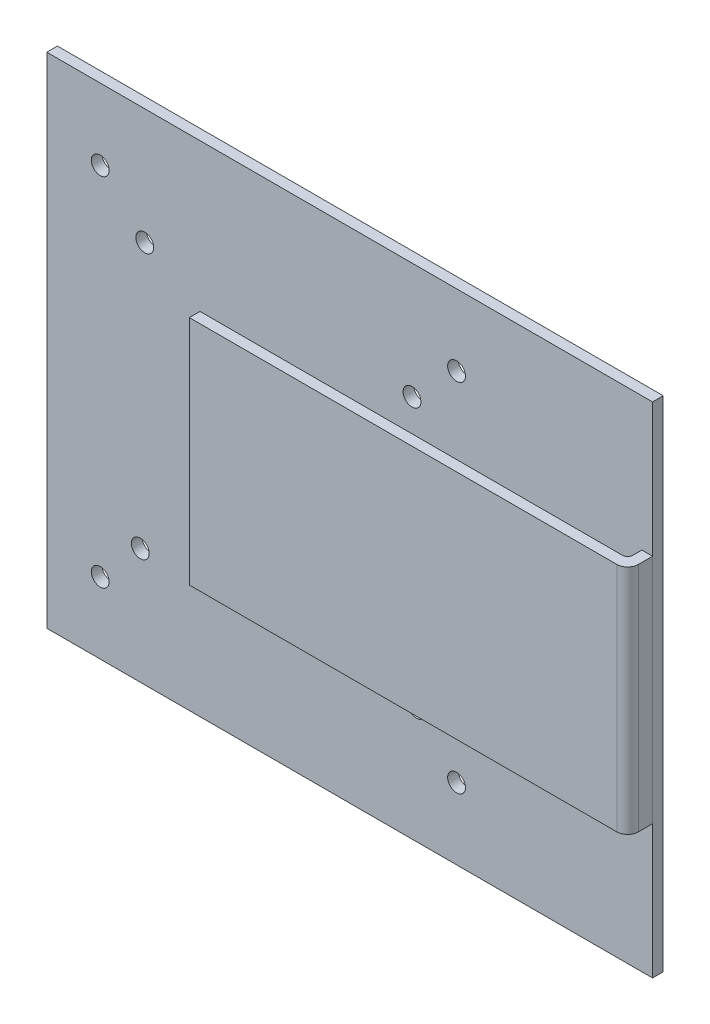
from build123d import *

# Parameters (mm, degrees)
SKETCH1_W            = 150
SKETCH1_H            = 150
BASE_FLANGE1_DEPTH   = 3
SKETCH23_W           = 150
SKETCH23_H           = 150
SKETCH23_W_2         = 140
SKETCH23_H_2         = 140
BOSS_EXTRUDE3_DEPTH  = 20
SKETCH27_W           = 7
SKETCH27_H           = 150
BOSS_EXTRUDE4_DEPTH  = 20
SKETCH31_R           = 2.5
CUT_EXTRUDE1_DEPTH   = 20
SKETCH33_W           = 170
SKETCH33_H           = 150
CUT_EXTRUDE3_DEPTH   = 20
SKETCH34_W           = 150
SKETCH34_H           = 150
SKETCH34_W_2         = 130
SKETCH34_H_2         = 130
CUT_EXTRUDE4_DEPTH   = 20
SKETCH39_W           = 40
SKETCH39_H           = 130
BOSS_EXTRUDE11_DEPTH = 3
BOSS_EXTRUDE14_DEPTH = 3
SKETCH47_W           = 3
SKETCH47_H           = 65
BOSS_EXTRUDE15_DEPTH = 120
FILLET3_R            = 1.5
FILLET4_R            = 3
SKETCH48_W           = 170
SKETCH48_H           = 3
BOSS_EXTRUDE16_DEPTH = 5
SKETCH49_W           = 170
SKETCH49_H           = 3
BOSS_EXTRUDE17_DEPTH = 5


# Sheet-metal steps are written as plain solids
with BuildPart() as part:
    # Sketch1 → Base-Flange1 (new body)
    with BuildSketch(Plane.XY):
        Rectangle(SKETCH1_W, SKETCH1_H)
    extrude(amount=-BASE_FLANGE1_DEPTH)

    # Sketch23 → Boss-Extrude3 (add)
    with BuildSketch(Plane(origin=(0, 0, -3), x_dir=(-1, 0, 0), z_dir=(0, 0, -1))):
        Rectangle(SKETCH23_W, SKETCH23_H)
        Rectangle(SKETCH23_W_2, SKETCH23_H_2, mode=Mode.SUBTRACT)
    extrude(amount=BOSS_EXTRUDE3_DEPTH)

    # Sketch27 → Boss-Extrude4 (add)
    with BuildSketch(Plane(origin=(75, 0, 0), x_dir=(0, 0, -1), z_dir=(1, 0, 0))):
        with Locations((19.5, 0)):
            Rectangle(SKETCH27_W, SKETCH27_H)
    extrude(amount=BOSS_EXTRUDE4_DEPTH)

    # Sketch31 → Cut-Extrude1 (cut)
    with BuildSketch(Plane.XY):
        with Locations((-50, -50)):
            Circle(SKETCH31_R)
        with Locations((-50, 50)):
            Circle(SKETCH31_R)
        with Locations((50, 50)):
            Circle(SKETCH31_R)
        with Locations((50, -50)):
            Circle(SKETCH31_R)
        with Locations((37.5, 37.5)):
            Circle(SKETCH31_R)
        with Locations((-37.5, 37.5)):
            Circle(SKETCH31_R)
        with Locations((38.751749061, -37.489553434)):
            Circle(SKETCH31_R)
        with Locations((-38.751749061, -37.489553434)):
            Circle(SKETCH31_R)
    extrude(amount=-CUT_EXTRUDE1_DEPTH, mode=Mode.SUBTRACT)

    # Sketch33 → Cut-Extrude3 (cut)
    with BuildSketch(Plane(origin=(0, 0, -23), x_dir=(-1, 0, 0), z_dir=(0, 0, -1))):
        with Locations((-10, 0)):
            Rectangle(SKETCH33_W, SKETCH33_H)
    extrude(amount=-CUT_EXTRUDE3_DEPTH, mode=Mode.SUBTRACT)

    # Sketch34 → Cut-Extrude4 (cut)
    with BuildSketch(Plane.XY):
        Rectangle(SKETCH34_W, SKETCH34_H)
        Rectangle(SKETCH34_W_2, SKETCH34_H_2, mode=Mode.SUBTRACT)
    extrude(amount=-CUT_EXTRUDE4_DEPTH, mode=Mode.SUBTRACT)

    # Sketch39 → Boss-Extrude11 (add)
    with BuildSketch(Plane.XY):
        with Locations((85, 0)):
            Rectangle(SKETCH39_W, SKETCH39_H)
    extrude(amount=-BOSS_EXTRUDE11_DEPTH)

    # Sketch48 → Boss-Extrude16 (add)
    with BuildSketch(Plane(origin=(0, -65, 0), x_dir=(-1, 0, 0), z_dir=(0, -1, 0))):
        with Locations((-20, 1.5)):
            Rectangle(SKETCH48_W, SKETCH48_H)
    extrude(amount=BOSS_EXTRUDE16_DEPTH)

    # Sketch49 → Boss-Extrude17 (add)
    with BuildSketch(Plane(origin=(0, 65, 0), x_dir=(1, 0, 0), z_dir=(0, 1, 0))):
        with Locations((20, 1.5)):
            Rectangle(SKETCH49_W, SKETCH49_H)
    extrude(amount=BOSS_EXTRUDE17_DEPTH)


with BuildPart() as body_2:
    # Sketch46 → Boss-Extrude14 (new body)
    with BuildSketch(Plane(origin=(105, 0, 0), x_dir=(0, 0, -1), z_dir=(1, 0, 0))):
        Polygon((0, 0), (0, 32.5), (-7, 32.5), (-7, -32.5), (0, -32.5), align=None)
    extrude(amount=-BOSS_EXTRUDE14_DEPTH)

    # Sketch47 → Boss-Extrude15 (add)
    with BuildSketch(Plane.ZY.offset(-102)):
        with Locations((5.5, 0)):
            Rectangle(SKETCH47_W, SKETCH47_H)
    extrude(amount=BOSS_EXTRUDE15_DEPTH)

    # Fillet3
    fillet3_edges = [body_2.edges().sort_by_distance(p)[0] for p in [
        (102, 0, 4),
    ]]
    fillet(fillet3_edges, radius=FILLET3_R)

    # Fillet4
    fillet4_edges = [body_2.edges().sort_by_distance(p)[0] for p in [
        (105, 0, 7),
    ]]
    fillet(fillet4_edges, radius=FILLET4_R)


solid = Compound([part.part, body_2.part])
